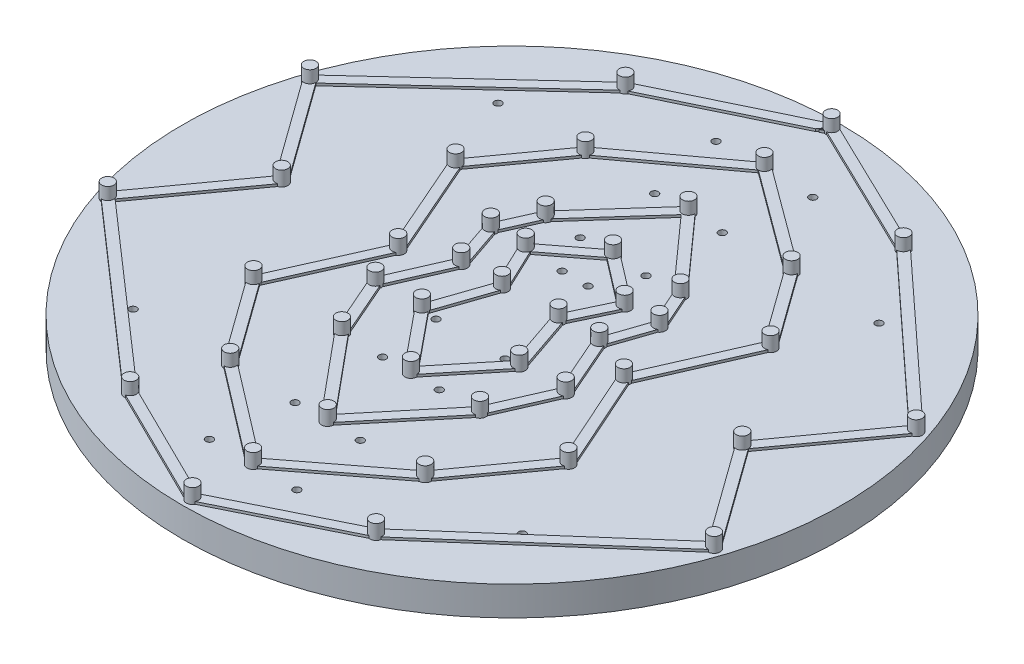
from build123d import *

# Parameters (mm, degrees)
SKETCH1_R           = 135
SKETCH1_R_2         = 7.082134324
BOSS_EXTRUDE3_DEPTH = 9
SKETCH4_R           = 135
BOSS_EXTRUDE4_DEPTH = 8
SKETCH5_R           = 2.5
SKETCH5_R_2         = 0.5
BOSS_EXTRUDE5_DEPTH = 10
BOSS_EXTRUDE7_DEPTH = 5
CUT_EXTRUDE2_START  = -9
SKETCH12_R          = 7.082134324
CUT_EXTRUDE2_DEPTH  = 9
SKETCH8_R           = 135
BOSS_EXTRUDE8_DEPTH = 4
SKETCH9_R           = 1.5
CUT_EXTRUDE1_DEPTH  = 18
CUT_EXTRUDE5_DEPTH  = 5


with BuildPart() as part:
    # Sketch1 → Boss-Extrude3 (new body)
    # profile 1 of 84: a face of its own
    with BuildSketch(Plane(origin=(0, 0, 0), x_dir=(1, 0, 0), z_dir=(0, 1, 0))):
        with Locations(Location((0, 0, 0), (0, 0, 270))):
            Circle(SKETCH1_R)
        with BuildLine():
            Line((-124.38352904, -41.253827153), (-124.277916907, -41.10729095))
            ThreePointArc((-124.277916907, -41.10729095), (-130.9, 0), (-124.277916907, 41.10729095))
            Line((-124.277916907, 41.10729095), (-124.38352904, 41.253827153))
            ThreePointArc((-124.38352904, 41.253827153), (-124.403249594, 41.513922755), (-124.180715089, 41.65))
            Line((-124.180715089, 41.65), (-124.097089007, 41.65))
            ThreePointArc((-124.097089007, 41.65), (-76.554277846, 106.180283214), (-0.308426084, 130.899636643))
            Line((-0.308426084, 130.899636643), (-0.202813951, 131.046172847))
            ThreePointArc((-0.202813951, 131.046172847), (0, 131.15), (0.202813951, 131.046172847))
            Line((0.202813951, 131.046172847), (0.308426084, 130.899636643))
            ThreePointArc((0.308426084, 130.899636643), (76.554277846, 106.180283214), (124.097089007, 41.65))
            Line((124.097089007, 41.65), (124.180715089, 41.65))
            ThreePointArc((124.180715089, 41.65), (124.403249594, 41.513922755), (124.38352904, 41.253827153))
            Line((124.38352904, 41.253827153), (124.277916907, 41.10729095))
            ThreePointArc((124.277916907, 41.10729095), (129.233875828, 20.8186296), (130.9, 0))
            ThreePointArc((130.9, 0), (129.233875828, -20.8186296), (124.277916907, -41.10729095))
            Line((124.277916907, -41.10729095), (124.38352904, -41.253827153))
            ThreePointArc((124.38352904, -41.253827153), (124.403249594, -41.513922755), (124.180715089, -41.65))
            Line((124.180715089, -41.65), (124.097089007, -41.65))
            ThreePointArc((124.097089007, -41.65), (76.554277846, -106.180283214), (0.308426084, -130.899636643))
            Line((0.308426084, -130.899636643), (0.202813951, -131.046172847))
            ThreePointArc((0.202813951, -131.046172847), (0, -131.15), (-0.202813951, -131.046172847))
            Line((-0.202813951, -131.046172847), (-0.308426084, -130.899636643))
            ThreePointArc((-0.308426084, -130.899636643), (-76.554277846, -106.180283214), (-124.097089007, -41.65))
            Line((-124.097089007, -41.65), (-124.180715089, -41.65))
            ThreePointArc((-124.180715089, -41.65), (-124.403249594, -41.513922755), (-124.38352904, -41.253827153))
        make_face(mode=Mode.SUBTRACT)
    # profile 2 of 84: a face of its own
    with BuildSketch(Plane(origin=(0, 0, 0), x_dir=(1, 0, 0), z_dir=(0, 1, 0))):
        with BuildLine():
            Line((94.650912929, 0), (124.277916907, -41.10729095))
            ThreePointArc((124.277916907, -41.10729095), (129.233875828, -20.8186296), (130.9, 0))
            ThreePointArc((130.9, 0), (129.233875828, 20.8186296), (124.277916907, 41.10729095))
            Line((124.277916907, 41.10729095), (94.650912929, 0))
        make_face()
    # profile 3 of 84: a face of its own
    with BuildSketch(Plane(origin=(0, 0, 0), x_dir=(1, 0, 0), z_dir=(0, 1, 0))):
        with BuildLine():
            Line((18.039369117, -106.298059158), (0.308426084, -130.899636643))
            ThreePointArc((0.308426084, -130.899636643), (76.554277846, -106.180283214), (124.097089007, -41.65))
            Line((124.097089007, -41.65), (64.889843958, -41.65))
            Line((64.889843958, -41.65), (79.924154275, -75.397063248))
            ThreePointArc((79.924154275, -75.397063248), (79.905473966, -75.634935118), (79.695790923, -75.748799079))
            Line((79.695790923, -75.748799079), (40.278539032, -75.748799079))
            Line((40.278539032, -75.748799079), (50.600214945, -105.967250897))
            ThreePointArc((50.600214945, -105.967250897), (50.566984629, -106.193486003), (50.363635096, -106.298059158))
            Line((50.363635096, -106.298059158), (18.039369117, -106.298059158))
        make_face()
    # profile 4 of 84: a face of its own
    with BuildSketch(Plane(origin=(0, 0, 0), x_dir=(1, 0, 0), z_dir=(0, 1, 0))):
        Polygon((39.848815576, -76.037582544), (18.399731029, -105.798059158), (50.014061514, -105.798059158), align=None)
    # profile 5 of 84: a face of its own
    with BuildSketch(Plane(origin=(0, 0, 0), x_dir=(1, 0, 0), z_dir=(0, 1, 0))):
        Polygon((0.382245002, -105.798059158), (17.78340262, -105.798059158), (39.44062029, -75.748799079), (13.528033374, -75.748799079), align=None)
    # profile 6 of 84: a face of its own
    with BuildSketch(Plane(origin=(0, 0, 0), x_dir=(1, 0, 0), z_dir=(0, 1, 0))):
        Polygon((-4e-09, -75.748799079), (-12.982280674, -75.748799079), (0, -105.42430559), (12.982280674, -75.748799079), align=None)
    # profile 7 of 84: a face of its own
    with BuildSketch(Plane(origin=(0, 0, 0), x_dir=(1, 0, 0), z_dir=(0, 1, 0))):
        Polygon((-2e-09, -106.298059158), (-17.423040707, -106.298059158), (0, -130.472424008), (17.423040707, -106.298059158), align=None)
    # profile 8 of 84: a face of its own
    with BuildSketch(Plane(origin=(0, 0, 0), x_dir=(1, 0, 0), z_dir=(0, 1, 0))):
        Polygon((-39.44062029, -75.748799079), (-17.78340262, -105.798059158), (-0.382245002, -105.798059158), (-13.528033374, -75.748799079), align=None)
    # profile 9 of 84: a face of its own
    with BuildSketch(Plane(origin=(0, 0, 0), x_dir=(1, 0, 0), z_dir=(0, 1, 0))):
        Polygon((-50.014061514, -105.798059158), (-18.399731029, -105.798059158), (-39.848815576, -76.037582544), align=None)
    # profile 10 of 84: a face of its own
    with BuildSketch(Plane(origin=(0, 0, 0), x_dir=(1, 0, 0), z_dir=(0, 1, 0))):
        with BuildLine():
            Line((-64.889843958, -41.65), (-124.097089007, -41.65))
            ThreePointArc((-124.097089007, -41.65), (-76.554277846, -106.180283214), (-0.308426084, -130.899636643))
            Line((-0.308426084, -130.899636643), (-18.039369117, -106.298059158))
            Line((-18.039369117, -106.298059158), (-50.363635096, -106.298059158))
            ThreePointArc((-50.363635096, -106.298059158), (-50.566984629, -106.193486003), (-50.600214945, -105.967250897))
            Line((-50.600214945, -105.967250897), (-40.278539032, -75.748799079))
            Line((-40.278539032, -75.748799079), (-79.695790923, -75.748799079))
            ThreePointArc((-79.695790923, -75.748799079), (-79.905473966, -75.634935118), (-79.924154275, -75.397063248))
            Line((-79.924154275, -75.397063248), (-64.889843958, -41.65))
        make_face()
    # profile 11 of 84: a face of its own
    with BuildSketch(Plane(origin=(0, 0, 0), x_dir=(1, 0, 0), z_dir=(0, 1, 0))):
        with BuildLine():
            ThreePointArc((-124.277916907, 41.10729095), (-130.9, 0), (-124.277916907, -41.10729095))
            Line((-124.277916907, -41.10729095), (-94.650912929, 0))
            Line((-94.650912929, 0), (-124.277916907, 41.10729095))
        make_face()
    # profile 12 of 84: a face of its own
    with BuildSketch(Plane(origin=(0, 0, 0), x_dir=(1, 0, 0), z_dir=(0, 1, 0))):
        with BuildLine():
            ThreePointArc((-0.308426084, 130.899636643), (-76.554277846, 106.180283214), (-124.097089007, 41.65))
            Line((-124.097089007, 41.65), (-64.887027362, 41.65))
            Line((-64.887027362, 41.65), (-78.251547748, 72.199247985))
            ThreePointArc((-78.251547748, 72.199247985), (-78.231730987, 72.436287213), (-78.022506278, 72.549447812))
            Line((-78.022506278, 72.549447812), (-42.629642686, 72.549447812))
            Line((-42.629642686, 72.549447812), (-57.169541703, 103.285033746))
            ThreePointArc((-57.169541703, 103.285033746), (-57.154771859, 103.525681685), (-56.943553046, 103.641940842))
            Line((-56.943553046, 103.641940842), (-19.953696869, 103.641940842))
            Line((-19.953696869, 103.641940842), (-0.308426084, 130.899636643))
        make_face()
    # profile 13 of 84: a face of its own
    with BuildSketch(Plane(origin=(0, 0, 0), x_dir=(1, 0, 0), z_dir=(0, 1, 0))):
        Polygon((-42.189962082, 72.789255758), (-20.314058782, 103.141940842), (-56.548724494, 103.141940842), align=None)
    # profile 14 of 84: a face of its own
    with BuildSketch(Plane(origin=(0, 0, 0), x_dir=(1, 0, 0), z_dir=(0, 1, 0))):
        Polygon((-0.385061599, 103.141940842), (-19.697730373, 103.141940842), (-41.746468973, 72.549447812), (-14.014011478, 72.549447812), align=None)
    # profile 15 of 84: a face of its own
    with BuildSketch(Plane(origin=(0, 0, 0), x_dir=(1, 0, 0), z_dir=(0, 1, 0))):
        Polygon((0, 102.777604677), (-13.466638187, 72.549447812), (0, 72.549447812), (13.466638187, 72.549447812), align=None)
    # profile 16 of 84: a face of its own
    with BuildSketch(Plane(origin=(0, 0, 0), x_dir=(1, 0, 0), z_dir=(0, 1, 0))):
        Polygon((0, 130.472424008), (-19.33736846, 103.641940842), (-4e-09, 103.641940842), (19.33736846, 103.641940842), align=None)
    # profile 17 of 84: a face of its own
    with BuildSketch(Plane(origin=(0, 0, 0), x_dir=(1, 0, 0), z_dir=(0, 1, 0))):
        Polygon((41.746468973, 72.549447812), (19.697730373, 103.141940842), (0.385061599, 103.141940842), (14.014011478, 72.549447812), align=None)
    # profile 18 of 84: a face of its own
    with BuildSketch(Plane(origin=(0, 0, 0), x_dir=(1, 0, 0), z_dir=(0, 1, 0))):
        Polygon((56.548724494, 103.141940842), (20.314058782, 103.141940842), (42.189962082, 72.789255758), align=None)
    # profile 19 of 84: a face of its own
    with BuildSketch(Plane(origin=(0, 0, 0), x_dir=(1, 0, 0), z_dir=(0, 1, 0))):
        Polygon((42.723159295, 72.049447812), (64.451376596, 41.901676169), (77.640261276, 72.049447812), align=None)
    # profile 20 of 84: a face of its own
    with BuildSketch(Plane(origin=(0, 0, 0), x_dir=(1, 0, 0), z_dir=(0, 1, 0))):
        Polygon((64.99312752, 41.15), (94.342748724, 0.427575992), (123.692369928, 41.15), align=None)
    # profile 21 of 84: a face of its own
    with BuildSketch(Plane(origin=(0, 0, 0), x_dir=(1, 0, 0), z_dir=(0, 1, 0))):
        Polygon((94.342748724, -0.427575992), (64.99312752, -41.15), (123.692369928, -41.15), align=None)
    # profile 22 of 84: a face of its own
    with BuildSketch(Plane(origin=(0, 0, 0), x_dir=(1, 0, 0), z_dir=(0, 1, 0))):
        Polygon((46.501999473, -0.37535968), (64.556200791, -40.90108124), (94.034584519, 0), (64.558188122, 40.898323831), align=None)
    # profile 23 of 84: a face of its own
    with BuildSketch(Plane(origin=(0, 0, 0), x_dir=(1, 0, 0), z_dir=(0, 1, 0))):
        Polygon((34.76781542, 25.964009606), (46.226642998, 0.242724701), (64.122537357, 41.15), (28.002459562, 41.15), align=None)
    # profile 24 of 84: a face of its own
    with BuildSketch(Plane(origin=(0, 0, 0), x_dir=(1, 0, 0), z_dir=(0, 1, 0))):
        Polygon((20.661887706, 26.112273784), (34.154390465, 26.112273784), (27.610580002, 40.800967905), align=None)
    # profile 25 of 84: a face of its own
    with BuildSketch(Plane(origin=(0, 0, 0), x_dir=(1, 0, 0), z_dir=(0, 1, 0))):
        Polygon((28.012226515, 41.65), (64.016437198, 41.65), (42.279666185, 71.809639867), align=None)
    # profile 26 of 84: a face of its own
    with BuildSketch(Plane(origin=(0, 0, 0), x_dir=(1, 0, 0), z_dir=(0, 1, 0))):
        Polygon((41.839985581, 72.049447812), (14.236761384, 72.049447812), (27.624215923, 41.999032095), align=None)
    # profile 27 of 84: a face of its own
    with BuildSketch(Plane(origin=(0, 0, 0), x_dir=(1, 0, 0), z_dir=(0, 1, 0))):
        Polygon((20.276224505, 26.46626798), (27.22256941, 41.15), (13.86765052, 41.15), align=None)
    # profile 28 of 84: a face of its own
    with BuildSketch(Plane(origin=(0, 0, 0), x_dir=(1, 0, 0), z_dir=(0, 1, 0))):
        Polygon((27.232336364, 41.65), (13.689388092, 72.049447812), (0.381882927, 72.049447812), (13.649430316, 41.65), align=None)
    # profile 29 of 84: a face of its own
    with BuildSketch(Plane(origin=(0, 0, 0), x_dir=(1, 0, 0), z_dir=(0, 1, 0))):
        Polygon((0, 71.674453378), (-13.103884665, 41.65), (0, 41.65), (13.103884665, 41.65), align=None)
    # profile 30 of 84: a face of its own
    with BuildSketch(Plane(origin=(0, 0, 0), x_dir=(1, 0, 0), z_dir=(0, 1, 0))):
        Polygon((-0.349573581, 41.15), (-13.322104869, 41.15), (-19.885176226, 26.112273784), (-5.485989484, 26.112273784), align=None)
    # profile 31 of 84: a face of its own
    with BuildSketch(Plane(origin=(0, 0, 0), x_dir=(1, 0, 0), z_dir=(0, 1, 0))):
        Polygon((-27.610580002, 40.800967905), (-34.154390465, 26.112273784), (-20.661887706, 26.112273784), align=None)
    # profile 32 of 84: a face of its own
    with BuildSketch(Plane(origin=(0, 0, 0), x_dir=(1, 0, 0), z_dir=(0, 1, 0))):
        Polygon((-13.86765052, 41.15), (-27.22256941, 41.15), (-20.276224505, 26.46626798), align=None)
    # profile 33 of 84: a face of its own
    with BuildSketch(Plane(origin=(0, 0, 0), x_dir=(1, 0, 0), z_dir=(0, 1, 0))):
        Polygon((-13.689388092, 72.049447812), (-27.232336364, 41.65), (-13.649430316, 41.65), (-0.381882927, 72.049447812), align=None)
    # profile 34 of 84: a face of its own
    with BuildSketch(Plane(origin=(0, 0, 0), x_dir=(1, 0, 0), z_dir=(0, 1, 0))):
        Polygon((-14.236761384, 72.049447812), (-41.839985581, 72.049447812), (-27.624215923, 41.999032095), align=None)
    # profile 35 of 84: a face of its own
    with BuildSketch(Plane(origin=(0, 0, 0), x_dir=(1, 0, 0), z_dir=(0, 1, 0))):
        Polygon((-77.640261276, 72.049447812), (-64.451376596, 41.901676169), (-42.723159295, 72.049447812), align=None)
    # profile 36 of 84: a face of its own
    with BuildSketch(Plane(origin=(0, 0, 0), x_dir=(1, 0, 0), z_dir=(0, 1, 0))):
        Polygon((-42.279666185, 71.809639867), (-64.016437198, 41.65), (-28.012226515, 41.65), align=None)
    # profile 37 of 84: a face of its own
    with BuildSketch(Plane(origin=(0, 0, 0), x_dir=(1, 0, 0), z_dir=(0, 1, 0))):
        Polygon((-64.122537357, 41.15), (-46.226642998, 0.242724701), (-34.767815423, 25.9640096), (-28.002459562, 41.15), align=None)
    # profile 38 of 84: a face of its own
    with BuildSketch(Plane(origin=(0, 0, 0), x_dir=(1, 0, 0), z_dir=(0, 1, 0))):
        Polygon((-123.692369928, 41.15), (-94.342748724, 0.427575992), (-64.99312752, 41.15), align=None)
    # profile 39 of 84: a face of its own
    with BuildSketch(Plane(origin=(0, 0, 0), x_dir=(1, 0, 0), z_dir=(0, 1, 0))):
        Polygon((-94.342748724, -0.427575992), (-123.692369928, -41.15), (-64.99312752, -41.15), align=None)
    # profile 40 of 84: a face of its own
    with BuildSketch(Plane(origin=(0, 0, 0), x_dir=(1, 0, 0), z_dir=(0, 1, 0))):
        Polygon((-64.558188122, 40.898323831), (-94.034584519, 0), (-64.556200791, -40.90108124), (-46.501999473, -0.37535968), align=None)
    # profile 41 of 84: a face of its own
    with BuildSketch(Plane(origin=(0, 0, 0), x_dir=(1, 0, 0), z_dir=(0, 1, 0))):
        Polygon((-46.230800318, -0.995279439), (-64.11972076, -41.15), (-28.66412955, -41.15), (-39.194128118, -17.080035031), align=None)
    # profile 42 of 84: a face of its own
    with BuildSketch(Plane(origin=(0, 0, 0), x_dir=(1, 0, 0), z_dir=(0, 1, 0))):
        Polygon((79.310729324, -75.248799079), (64.453363927, -41.89891876), (40.417310612, -75.248799079), align=None)
    # profile 43 of 84: a face of its own
    with BuildSketch(Plane(origin=(0, 0, 0), x_dir=(1, 0, 0), z_dir=(0, 1, 0))):
        Polygon((-40.417310612, -75.248799079), (-64.453363927, -41.89891876), (-79.310729324, -75.248799079), align=None)
    # profile 44 of 84: a face of its own
    with BuildSketch(Plane(origin=(0, 0, 0), x_dir=(1, 0, 0), z_dir=(0, 1, 0))):
        Polygon((-28.631458129, -41.65), (-64.016437198, -41.65), (-40.009115326, -74.960015614), align=None)
    # profile 45 of 84: a face of its own
    with BuildSketch(Plane(origin=(0, 0, 0), x_dir=(1, 0, 0), z_dir=(0, 1, 0))):
        Polygon((-13.746770679, -75.248799079), (-28.253174133, -42.089381183), (-39.579391869, -75.248799079), align=None)
    # profile 46 of 84: a face of its own
    with BuildSketch(Plane(origin=(0, 0, 0), x_dir=(1, 0, 0), z_dir=(0, 1, 0))):
        Polygon((-11.798316719, -41.65), (-27.899639545, -41.65), (-13.20101798, -75.248799079), (-0.349305009, -75.248799079), align=None)
    # profile 47 of 84: a face of its own
    with BuildSketch(Plane(origin=(0, 0, 0), x_dir=(1, 0, 0), z_dir=(0, 1, 0))):
        Polygon((1e-09, -41.65), (-11.270084989, -41.65), (0, -74.72371245), (11.270084989, -41.65), align=None)
    # profile 48 of 84: a face of its own
    with BuildSketch(Plane(origin=(0, 0, 0), x_dir=(1, 0, 0), z_dir=(0, 1, 0))):
        Polygon((28.253174133, -42.089381183), (13.746770679, -75.248799079), (39.579391869, -75.248799079), align=None)
    # profile 49 of 84: a face of its own
    with BuildSketch(Plane(origin=(0, 0, 0), x_dir=(1, 0, 0), z_dir=(0, 1, 0))):
        Polygon((28.66412955, -41.15), (64.11972076, -41.15), (46.230800318, -0.995279439), (39.194128143, -17.080034973), align=None)
    # profile 50 of 84: a face of its own
    with BuildSketch(Plane(origin=(0, 0, 0), x_dir=(1, 0, 0), z_dir=(0, 1, 0))):
        Polygon((40.009115326, -74.960015614), (64.016437198, -41.65), (28.631458129, -41.65), align=None)
    # profile 51 of 84: a face of its own
    with BuildSketch(Plane(origin=(0, 0, 0), x_dir=(1, 0, 0), z_dir=(0, 1, 0))):
        Polygon((0.349305009, -75.248799079), (13.20101798, -75.248799079), (27.899639545, -41.65), (11.798316719, -41.65), align=None)
    # profile 52 of 84: a face of its own
    with BuildSketch(Plane(origin=(0, 0, 0), x_dir=(1, 0, 0), z_dir=(0, 1, 0))):
        Polygon((19.94100333, -17.754095418), (11.968695007, -41.15), (27.932310966, -41.15), align=None)
    # profile 53 of 84: a face of its own
    with BuildSketch(Plane(origin=(0, 0, 0), x_dir=(1, 0, 0), z_dir=(0, 1, 0))):
        Polygon((20.290295308, -17.229835196), (28.310594963, -40.710618817), (38.582841649, -17.229835196), align=None)
    # profile 54 of 84: a face of its own
    with BuildSketch(Plane(origin=(0, 0, 0), x_dir=(1, 0, 0), z_dir=(0, 1, 0))):
        Polygon((38.965357754, -16.355461929), (45.955443842, -0.377195058), (34.57048907, 25.178269787), (28.549732773, 7.509480006), align=None)
    # profile 55 of 84: a face of its own
    with BuildSketch(Plane(origin=(0, 0, 0), x_dir=(1, 0, 0), z_dir=(0, 1, 0))):
        Polygon((20.64894208, 25.612273784), (28.253100546, 8.189142616), (34.190147055, 25.612273784), align=None)
    # profile 56 of 84: a face of its own
    with BuildSketch(Plane(origin=(0, 0, 0), x_dir=(1, 0, 0), z_dir=(0, 1, 0))):
        Polygon((19.885176226, 26.112273784), (13.322104869, 41.15), (0.349573581, 41.15), (5.485989484, 26.112273784), align=None)
    # profile 57 of 84: a face of its own
    with BuildSketch(Plane(origin=(0, 0, 0), x_dir=(1, 0, 0), z_dir=(0, 1, 0))):
        Polygon((0, 40.626564221), (-4.957626648, 26.112273784), (4.957626648, 26.112273784), align=None)
    # profile 58 of 84: a face of its own
    with BuildSketch(Plane(origin=(0, 0, 0), x_dir=(1, 0, 0), z_dir=(0, 1, 0))):
        Polygon((-34.190147055, 25.612273784), (-28.253100546, 8.189142616), (-20.64894208, 25.612273784), align=None)
    # profile 59 of 84: a face of its own
    with BuildSketch(Plane(origin=(0, 0, 0), x_dir=(1, 0, 0), z_dir=(0, 1, 0))):
        Polygon((-34.57048907, 25.178269787), (-45.955443842, -0.377195058), (-38.965357754, -16.355461929), (-28.549732773, 7.509480006), align=None)
    # profile 60 of 84: a face of its own
    with BuildSketch(Plane(origin=(0, 0, 0), x_dir=(1, 0, 0), z_dir=(0, 1, 0))):
        Polygon((-38.582841649, -17.229835196), (-28.310594963, -40.710618817), (-20.290295308, -17.229835196), align=None)
    # profile 61 of 84: a face of its own
    with BuildSketch(Plane(origin=(0, 0, 0), x_dir=(1, 0, 0), z_dir=(0, 1, 0))):
        Polygon((-19.94100333, -17.754095418), (-27.932310966, -41.15), (-11.968695007, -41.15), align=None)
    # profile 62 of 84: a face of its own
    with BuildSketch(Plane(origin=(0, 0, 0), x_dir=(1, 0, 0), z_dir=(0, 1, 0))):
        Polygon((-19.591416717, -17.229835196), (-11.440463277, -41.15), (-0.433398927, -41.15), (-14.268343199, -17.229835196), align=None)
    # profile 63 of 84: a face of its own
    with BuildSketch(Plane(origin=(0, 0, 0), x_dir=(1, 0, 0), z_dir=(0, 1, 0))):
        Polygon((3e-09, -17.229835196), (-13.690735332, -17.229835196), (0, -40.900667473), (13.690735332, -17.229835196), align=None)
    # profile 64 of 84: a face of its own
    with BuildSketch(Plane(origin=(0, 0, 0), x_dir=(1, 0, 0), z_dir=(0, 1, 0))):
        Polygon((0.433398927, -41.15), (11.440463277, -41.15), (19.591416717, -17.229835196), (14.268343199, -17.229835196), align=None)
    # profile 65 of 84: a face of its own
    with BuildSketch(Plane(origin=(0, 0, 0), x_dir=(1, 0, 0), z_dir=(0, 1, 0))):
        Polygon((38.583203725, -16.729835196), (28.310542102, 6.807540005), (20.290026735, -16.729835196), align=None)
    # profile 66 of 84: a face of its own
    with BuildSketch(Plane(origin=(0, 0, 0), x_dir=(1, 0, 0), z_dir=(0, 1, 0))):
        Polygon((27.899938397, 7.74834131), (20.257893801, 25.258279588), (11.974572478, 7.74834131), align=None)
    # profile 67 of 84: a face of its own
    with BuildSketch(Plane(origin=(0, 0, 0), x_dir=(1, 0, 0), z_dir=(0, 1, 0))):
        Polygon((19.872230601, 25.612273784), (5.656773811, 25.612273784), (11.61719592, 8.162130043), align=None)
    # profile 68 of 84: a face of its own
    with BuildSketch(Plane(origin=(0, 0, 0), x_dir=(1, 0, 0), z_dir=(0, 1, 0))):
        Polygon((-5.656773811, 25.612273784), (-19.872230601, 25.612273784), (-11.61719592, 8.162130043), align=None)
    # profile 69 of 84: a face of its own
    with BuildSketch(Plane(origin=(0, 0, 0), x_dir=(1, 0, 0), z_dir=(0, 1, 0))):
        Polygon((5.128410975, 25.612273784), (-5.128410975, 25.612273784), (-11.230170344, 7.74834131), (2.5e-08, 7.74834131), (11.230170344, 7.74834131), align=None)
    # profile 70 of 84: a face of its own
    with BuildSketch(Plane(origin=(0, 0, 0), x_dir=(1, 0, 0), z_dir=(0, 1, 0))):
        Polygon((-20.290026735, -16.729835196), (-28.310542102, 6.807540005), (-38.583203725, -16.729835196), align=None)
    # profile 71 of 84: a face of its own
    with BuildSketch(Plane(origin=(0, 0, 0), x_dir=(1, 0, 0), z_dir=(0, 1, 0))):
        Polygon((-11.974572478, 7.74834131), (-20.257893801, 25.258279588), (-27.899938397, 7.74834131), align=None)
    # profile 72 of 84: a face of its own
    with BuildSketch(Plane(origin=(0, 0, 0), x_dir=(1, 0, 0), z_dir=(0, 1, 0))):
        Polygon((-27.22480771, 5.171466918), (-19.940440123, -16.205574975), (-18.054398633, -10.683869549), align=None)
    # profile 73 of 84: a face of its own
    with BuildSketch(Plane(origin=(0, 0, 0), x_dir=(1, 0, 0), z_dir=(0, 1, 0))):
        Polygon((-11.929317507, 7.24834131), (-27.848422397, 7.24834131), (-17.839938025, -10.05599985), align=None)
    # profile 74 of 84: a face of its own
    with BuildSketch(Plane(origin=(0, 0, 0), x_dir=(1, 0, 0), z_dir=(0, 1, 0))):
        Polygon((11.929317507, 7.24834131), (17.839938025, -10.05599985), (27.848422397, 7.24834131), align=None)
    # profile 75 of 84: a face of its own
    with BuildSketch(Plane(origin=(0, 0, 0), x_dir=(1, 0, 0), z_dir=(0, 1, 0))):
        Polygon((18.054398633, -10.683869549), (19.940440123, -16.205574975), (27.22480771, 5.171466918), align=None)
    # profile 76 of 84: a face of its own
    with BuildSketch(Plane(origin=(0, 0, 0), x_dir=(1, 0, 0), z_dir=(0, 1, 0))):
        Polygon((17.722212167, -11.25820905), (14.557533185, -16.729835196), (19.591148145, -16.729835196), align=None)
    # profile 77 of 84: a face of its own
    with BuildSketch(Plane(origin=(0, 0, 0), x_dir=(1, 0, 0), z_dir=(0, 1, 0))):
        Polygon((-17.722212167, -11.25820905), (-19.591148145, -16.729835196), (-14.557533185, -16.729835196), align=None)
    # profile 78 of 84: a face of its own
    with BuildSketch(Plane(origin=(0, 0, 0), x_dir=(1, 0, 0), z_dir=(0, 1, 0))):
        Polygon((-17.50775156, -10.630339352), (-13.979925318, -16.729835196), (-0.394828552, -16.729835196), (-6.853905402, -3.076128844), (-11.542291931, 6.834552578), align=None)
    # profile 79 of 84: a face of its own
    with BuildSketch(Plane(origin=(0, 0, 0), x_dir=(1, 0, 0), z_dir=(0, 1, 0))):
        Polygon((0.394828552, -16.729835196), (13.979925318, -16.729835196), (17.50775156, -10.630339352), (11.542291931, 6.834552578), (6.853905369, -3.076128913), align=None)
    # profile 80 of 84: a face of its own
    with BuildSketch(Plane(origin=(0, 0, 0), x_dir=(1, 0, 0), z_dir=(0, 1, 0))):
        with BuildLine():
            Line((-5.243999611, -5.310035244), (0, -16.395215445))
            Line((0, -16.395215445), (5.243999611, -5.310035244))
            ThreePointArc((5.243999611, -5.310035244), (0, -7.415927337), (-5.243999611, -5.310035244))
        make_face()
    # profile 81 of 84: a face of its own
    with BuildSketch(Plane(origin=(0, 0, 0), x_dir=(1, 0, 0), z_dir=(0, 1, 0))):
        with BuildLine():
            Line((-11.184915373, 7.24834131), (-7.559856546, -0.414594104))
            ThreePointArc((-7.559856546, -0.414594104), (-6.405957651, 4.222371119), (-2.707791411, 7.24834131))
            Line((-2.707791411, 7.24834131), (-11.184915373, 7.24834131))
        make_face()
    # profile 82 of 84: a face of its own
    with BuildSketch(Plane(origin=(0, 0, 0), x_dir=(1, 0, 0), z_dir=(0, 1, 0))):
        with BuildLine():
            ThreePointArc((7.582134324, 0.166206987), (7.576562832, -0.124407107), (7.559856546, -0.414594104))
            Line((7.559856546, -0.414594104), (11.184915373, 7.24834131))
            Line((11.184915373, 7.24834131), (2.707791411, 7.24834131))
            ThreePointArc((2.707791411, 7.24834131), (6.245782541, 4.464923232), (7.582134324, 0.166206987))
        make_face()
    # profile 83 of 84: a face of its own
    with BuildSketch(Plane(origin=(0, 0, 0), x_dir=(1, 0, 0), z_dir=(0, 1, 0))):
        with Locations(Location((0, 0.166206987, 0), (0, 0, 270))):
            Circle(SKETCH1_R_2)
    # profile 84 of 84: a face of its own
    with BuildSketch(Plane(origin=(0, 0, 0), x_dir=(1, 0, 0), z_dir=(0, 1, 0))):
        with BuildLine():
            ThreePointArc((124.097089007, 41.65), (76.554277846, 106.180283214), (0.308426084, 130.899636643))
            Line((0.308426084, 130.899636643), (19.953696869, 103.641940842))
            Line((19.953696869, 103.641940842), (56.943553046, 103.641940842))
            ThreePointArc((56.943553046, 103.641940842), (57.154771859, 103.525681685), (57.169541703, 103.285033746))
            Line((57.169541703, 103.285033746), (42.629642686, 72.549447812))
            Line((42.629642686, 72.549447812), (78.022506278, 72.549447812))
            ThreePointArc((78.022506278, 72.549447812), (78.231730987, 72.436287213), (78.251547748, 72.199247985))
            Line((78.251547748, 72.199247985), (64.887027362, 41.65))
            Line((64.887027362, 41.65), (124.097089007, 41.65))
        make_face()
    extrude(amount=BOSS_EXTRUDE3_DEPTH)

    # Sketch4 → Boss-Extrude4 (add)
    with BuildSketch(Plane.XZ):
        with Locations(Location((0, 0, 0), (0, 0, 270))):
            Circle(SKETCH4_R)
    extrude(amount=-BOSS_EXTRUDE4_DEPTH)

    # Sketch5 → Boss-Extrude5 (add)
    with BuildSketch(Plane(origin=(0, 8, 0), x_dir=(1, 0, 0), z_dir=(0, 1, 0))):
        with Locations(Location((-64.504782359, 41.4, 0), (0, 0, 107.888986274))):
            Circle(SKETCH5_R)
        with Locations(Location((-64.504782359, -41.4, 0), (0, 0, 71.726207321))):
            Circle(SKETCH5_R)
        with Locations(Location((64.504782359, -41.4, 0), (0, 0, 108.273792679))):
            Circle(SKETCH5_R)
        with Locations(Location((64.504782359, 41.4, 0), (0, 0, 72.111013726))):
            Circle(SKETCH5_R)
        with Locations(Location((-124.180715089, 41.4, 0), (0, 0, 5.739170477))):
            Circle(SKETCH5_R)
        with Locations(Location((-124.180715089, -41.4, 0), (0, 0, 59.957979549))):
            Circle(SKETCH5_R)
        with Locations(Location((124.180715089, -41.4, 0), (0, 0, 120.042020451))):
            Circle(SKETCH5_R)
        with Locations(Location((124.180715089, 41.4, 0), (0, 0, 174.260829523))):
            Circle(SKETCH5_R)
        with Locations(Location((0, -130.9, 0), (0, 0, 59.957979549))):
            Circle(SKETCH5_R)
        with Locations(Location((0, 130.9, 0), (0, 0, 228.479638594))):
            Circle(SKETCH5_R)
        with Locations(Location((-50.363635096, -106.048059158, 0), (0, 0, 76.880611758))):
            Circle(SKETCH5_R)
        with Locations(Location((50.363635096, -106.048059158, 0), (0, 0, 103.119388242))):
            Circle(SKETCH5_R)
        with Locations(Location((0, -106.048059158, 0), (0, 0, 107.888986274))):
            Circle(SKETCH5_R)
        with Locations(Location((0, 103.391940842, 0), (0, 0, 5.739170477))):
            Circle(SKETCH5_R)
        with Locations(Location((94.342748724, 0, 0), (0, 0, 59.957979549))):
            Circle(SKETCH5_R)
        with Locations(Location((56.943553046, 103.391940842, 0), (0, 0, 174.260829523))):
            Circle(SKETCH5_R)
        with Locations(Location((-56.943553046, 103.391940842, 0), (0, 0, 5.739170477))):
            Circle(SKETCH5_R)
        with Locations(Location((-42.234814134, 72.299447812, 0), (0, 0, 109.577974891))):
            Circle(SKETCH5_R)
        with Locations(Location((-39.928965451, -75.498799079, 0), (0, 0, 76.880611758))):
            Circle(SKETCH5_R)
        with Locations(Location((39.928965451, -75.498799079, 0), (0, 0, 103.119388242))):
            Circle(SKETCH5_R)
        with Locations(Location((46.228721658, -0.376277369, 0), (0, 0, 72.111013726))):
            Circle(SKETCH5_R)
        with Locations(Location((42.234814134, 72.299447812, 0), (0, 0, 70.422025109))):
            Circle(SKETCH5_R)
        with Locations(Location((0, 72.299447812, 0), (0, 0, 5.739170477))):
            Circle(SKETCH5_R)
        with Locations(Location((-27.617397963, 41.4, 0), (0, 0, 71.726207321))):
            Circle(SKETCH5_R)
        with Locations(Location((-34.539452064, 25.862273784, 0), (0, 0, 71.726207321))):
            Circle(SKETCH5_R)
        with Locations(Location((-28.281821324, 7.49834131, 0), (0, 0, 103.077710518))):
            Circle(SKETCH5_R)
        with Locations(Location((-38.965086652, -16.979835196, 0), (0, 0, 72.160769311))):
            Circle(SKETCH5_R)
        with Locations(Location((-28.281884548, -41.4, 0), (0, 0, 76.880611758))):
            Circle(SKETCH5_R)
        with Locations(Location((0, -75.498799079, 0), (0, 0, 76.922289482))):
            Circle(SKETCH5_R)
        with Locations(Location((28.281884548, -41.4, 0), (0, 0, 103.119388242))):
            Circle(SKETCH5_R)
        with Locations(Location((38.965086652, -16.979835196, 0), (0, 0, 107.839230689))):
            Circle(SKETCH5_R)
        with Locations(Location((28.281821324, 7.49834131, 0), (0, 0, 76.922289482))):
            Circle(SKETCH5_R)
        with Locations(Location((34.539452064, 25.862273784, 0), (0, 0, 108.273792679))):
            Circle(SKETCH5_R)
        with Locations(Location((27.617397963, 41.4, 0), (0, 0, 108.273792679))):
            Circle(SKETCH5_R)
        with Locations(Location((-94.342748724, 0, 0), (0, 0, 59.957979549))):
            Circle(SKETCH5_R)
        with Locations(Location((-46.228721658, -0.376277369, 0), (0, 0, 107.888986274))):
            Circle(SKETCH5_R)
        with Locations(Location((0, -41.4, 0), (0, 0, 65.694941947))):
            Circle(SKETCH5_R)
        with Locations(Location((19.940721726, -16.979835196, 0), (0, 0, 76.922289482))):
            Circle(SKETCH5_R)
        with Locations(Location((11.579743926, 7.49834131, 0), (0, 0, 103.119388242))):
            Circle(SKETCH5_R)
        with Locations(Location((20.267059153, 25.862273784, 0), (0, 0, 107.839230689))):
            Circle(SKETCH5_R)
        with Locations(Location((0, 41.4, 0), (0, 0, 5.739170477))):
            Circle(SKETCH5_R)
        with Locations(Location((-20.267059153, 25.862273784, 0), (0, 0, 72.160769311))):
            Circle(SKETCH5_R)
        with Locations(Location((-11.579743926, 7.49834131, 0), (0, 0, 76.880611758))):
            Circle(SKETCH5_R)
        with Locations(Location((-19.940721726, -16.979835196, 0), (0, 0, 103.077710518))):
            Circle(SKETCH5_R)
        with Locations(Location((-79.695790923, -75.498799079, 0), (0, 0, 95.987036844))):
            Circle(SKETCH5_R_2)
        with Locations(Location((-78.022506278, 72.299447812, 0), (0, 0, 30))):
            Circle(SKETCH5_R_2)
        with Locations(Location((78.022506278, 72.299447812, 0), (0, 0, 150))):
            Circle(SKETCH5_R_2)
        with Locations(Location((79.695790923, -75.498799079, 0), (0, 0, 84.012963156))):
            Circle(SKETCH5_R_2)
        with Locations(Location((-17.911385868, -106.048059158, 0), (0, 0, 95.781190929))):
            Circle(SKETCH5_R_2)
        with Locations(Location((17.911385868, -106.048059158, 0), (0, 0, 84.218809071))):
            Circle(SKETCH5_R_2)
        with Locations(Location((19.825713621, 103.391940842, 0), (0, 0, 95.781190929))):
            Circle(SKETCH5_R_2)
        with Locations(Location((-19.825713621, 103.391940842, 0), (0, 0, 84.218809071))):
            Circle(SKETCH5_R_2)
        with Locations(Location((13.851699785, 72.299447812, 0), (0, 0, 84.012963156))):
            Circle(SKETCH5_R_2)
        with Locations(Location((-13.851699785, 72.299447812, 0), (0, 0, 95.987036844))):
            Circle(SKETCH5_R_2)
        with Locations(Location((13.485767593, 41.4, 0), (0, 0, 83.578401166))):
            Circle(SKETCH5_R_2)
        with Locations(Location((-13.485767593, 41.4, 0), (0, 0, 96.421598834))):
            Circle(SKETCH5_R_2)
        with Locations(Location((5.307200229, 25.862273784, 0), (0, 0, 78.85855872))):
            Circle(SKETCH5_R_2)
        with Locations(Location((-5.307200229, 25.862273784, 0), (0, 0, 101.14144128))):
            Circle(SKETCH5_R_2)
        with Locations(Location((14.124134258, -16.979835196, 0), (0, 0, 89.95577147))):
            Circle(SKETCH5_R_2)
        with Locations(Location((-14.124134258, -16.979835196, 0), (0, 0, 90.04422853))):
            Circle(SKETCH5_R_2)
        with Locations(Location((11.619389998, -41.4, 0), (0, 0, 101.183119005))):
            Circle(SKETCH5_R_2)
        with Locations(Location((-11.619389998, -41.4, 0), (0, 0, 78.816880995))):
            Circle(SKETCH5_R_2)
        with Locations(Location((-13.364525677, -75.498799079, 0), (0, 0, 83.628156752))):
            Circle(SKETCH5_R_2)
        with Locations(Location((13.364525677, -75.498799079, 0), (0, 0, 96.371843248))):
            Circle(SKETCH5_R_2)
    extrude(amount=BOSS_EXTRUDE5_DEPTH)

    # Boss-Extrude7: read off the stored shape, not the designer's step
    # Boss-Extrude7 outline → Boss-Extrude7 (add)
    with BuildSketch(Plane(origin=(0, 8, 0), x_dir=(1, 0, 0), z_dir=(0, 1, 0))):
        with BuildLine():
            Line((-1.251587511, 128.735853817), (-1.983110413, 127.720870163))
            Line((-1.983110413, 127.720870163), (-0.480698107, 128.446649367))
            ThreePointArc((-0.480698107, 128.446649367), (-0.878130497, 128.559297791), (-1.251587511, 128.735853817))
        make_face()
        with BuildLine():
            Line((-2.928637685, 127.264108708), (-1.657215414, 129.02819951))
            ThreePointArc((-1.657215414, 129.02819951), (-2.457604414, 130.441545481), (-2.220621138, 132.04840836))
            Line((-2.220621138, 132.04840836), (-56.46285494, 105.845291476))
            ThreePointArc((-56.46285494, 105.845291476), (-54.692453676, 104.479392737), (-54.722931908, 102.243532483))
            Line((-54.722931908, 102.243532483), (-2.928637685, 127.264108708))
        make_face()
        with BuildLine():
            ThreePointArc((2.220621138, 132.04840836), (2.251099371, 129.812548106), (0.480698107, 128.446649367))
            Line((0.480698107, 128.446649367), (54.722931908, 102.243532483))
            ThreePointArc((54.722931908, 102.243532483), (54.692453676, 104.479392737), (56.46285494, 105.845291476))
            Line((56.46285494, 105.845291476), (2.220621138, 132.04840836))
        make_face()
        with BuildLine():
            Line((56.690659405, 100.904764771), (121.521700716, 41.131241387))
            Line((121.521700716, 41.131241387), (93.597274194, 2.386266482))
            ThreePointArc((93.597274194, 2.386266482), (95.804477192, 2.028139513), (96.842297416, 0.047500933))
            Line((96.842297416, 0.047500933), (124.926189619, 39.013733518))
            ThreePointArc((124.926189619, 39.013733518), (121.693388144, 41.148594612), (124.43360873, 43.887176071))
            Line((124.43360873, 43.887176071), (59.402052293, 103.845572246))
            ThreePointArc((59.402052293, 103.845572246), (58.781557718, 101.697320287), (56.690659405, 100.904764771))
        make_face()
        with BuildLine():
            Line((-121.521700716, 41.131241387), (-56.690659405, 100.904764771))
            ThreePointArc((-56.690659405, 100.904764771), (-58.781557718, 101.697320287), (-59.402052293, 103.845572246))
            Line((-59.402052293, 103.845572246), (-124.43360873, 43.887176071))
            ThreePointArc((-124.43360873, 43.887176071), (-121.693388144, 41.148594612), (-124.926189619, 39.013733518))
            Line((-124.926189619, 39.013733518), (-96.842297416, 0.047500933))
            ThreePointArc((-96.842297416, 0.047500933), (-95.804477192, 2.028139513), (-93.597274194, 2.386266482))
            Line((-93.597274194, 2.386266482), (-121.521700716, 41.131241387))
        make_face()
        with BuildLine():
            Line((93.597274194, -2.386266482), (121.494711581, -41.093794124))
            Line((121.494711581, -41.093794124), (50.174379813, -103.555232963))
            ThreePointArc((50.174379813, -103.555232963), (52.244342882, -104.400959215), (52.809739722, -106.564365421))
            Line((52.809739722, -106.564365421), (124.369970371, -43.892826195))
            ThreePointArc((124.369970371, -43.892826195), (121.696803598, -41.116832724), (124.926189619, -39.013733518))
            Line((124.926189619, -39.013733518), (96.842297416, -0.047500933))
            ThreePointArc((96.842297416, -0.047500933), (95.804477192, -2.028139513), (93.597274194, -2.386266482))
        make_face()
        with BuildLine():
            Line((-121.494711581, -41.093794124), (-93.597274194, -2.386266482))
            ThreePointArc((-93.597274194, -2.386266482), (-95.804477192, -2.028139513), (-96.842297416, -0.047500933))
            Line((-96.842297416, -0.047500933), (-124.926189619, -39.013733518))
            ThreePointArc((-124.926189619, -39.013733518), (-121.696803598, -41.116832724), (-124.369970371, -43.892826195))
            Line((-124.369970371, -43.892826195), (-52.809739722, -106.564365421))
            ThreePointArc((-52.809739722, -106.564365421), (-52.244342882, -104.400959215), (-50.174379813, -103.555232963))
            Line((-50.174379813, -103.555232963), (-121.494711581, -41.093794124))
        make_face()
        with BuildLine():
            ThreePointArc((49.903505498, -108.505350503), (48.121724261, -107.154330286), (48.133471693, -104.918293167))
            Line((48.133471693, -104.918293167), (0.460129598, -128.442708655))
            ThreePointArc((0.460129598, -128.442708655), (2.241910835, -129.793728872), (2.230163403, -132.029765991))
            Line((2.230163403, -132.029765991), (49.903505498, -108.505350503))
        make_face()
        with BuildLine():
            Line((-0.460129598, -128.442708655), (-48.133471693, -104.918293167))
            ThreePointArc((-48.133471693, -104.918293167), (-48.121724261, -107.154330286), (-49.903505498, -108.505350503))
            Line((-49.903505498, -108.505350503), (-2.230163403, -132.029765991))
            ThreePointArc((-2.230163403, -132.029765991), (-2.241910835, -129.793728872), (-0.460129598, -128.442708655))
        make_face()
        with BuildLine():
            Line((-62.005233667, 41.447500933), (-41.489339604, 69.91318133))
            ThreePointArc((-41.489339604, 69.91318133), (-43.696542602, 70.271308299), (-44.734362826, 72.251946879))
            Line((-44.734362826, 72.251946879), (-65.250256889, 43.786266482))
            ThreePointArc((-65.250256889, 43.786266482), (-63.043053891, 43.428139513), (-62.005233667, 41.447500933))
        make_face()
        with BuildLine():
            Line((-39.841140973, 71.578109613), (-0.022256186, 100.892039912))
            ThreePointArc((-0.022256186, 100.892039912), (-2.013274456, 101.909805233), (-2.393673161, 104.113279041))
            Line((-2.393673161, 104.113279041), (-42.212557948, 74.799348742))
            ThreePointArc((-42.212557948, 74.799348742), (-40.221539678, 73.781583422), (-39.841140973, 71.578109613))
        make_face()
        with BuildLine():
            Line((-44.997588871, 1.799570066), (-62.071251641, 40.827349807))
            ThreePointArc((-62.071251641, 40.827349807), (-63.502784083, 39.109585309), (-65.735915146, 39.224152565))
            Line((-65.735915146, 39.224152565), (-48.662252376, 0.196372824))
            ThreePointArc((-48.662252376, 0.196372824), (-47.230719934, 1.914137322), (-44.997588871, 1.799570066))
        make_face()
        with BuildLine():
            Line((0.022256186, 100.892039912), (39.841140973, 71.578109613))
            ThreePointArc((39.841140973, 71.578109613), (40.221539678, 73.781583422), (42.212557948, 74.799348742))
            Line((42.212557948, 74.799348742), (2.393673161, 104.113279041))
            ThreePointArc((2.393673161, 104.113279041), (2.013274456, 101.909805233), (0.022256186, 100.892039912))
        make_face()
        with BuildLine():
            Line((-62.067460555, -40.843706529), (-45.012229821, -2.560344128))
            ThreePointArc((-45.012229821, -2.560344128), (-47.246079963, -2.659910895), (-48.666043462, -0.93257084))
            Line((-48.666043462, -0.93257084), (-65.721274196, -39.215933241))
            ThreePointArc((-65.721274196, -39.215933241), (-63.487424054, -39.116366475), (-62.067460555, -40.843706529))
        make_face()
        with BuildLine():
            Line((41.489339604, 69.91318133), (62.005233667, 41.447500933))
            ThreePointArc((62.005233667, 41.447500933), (63.043053891, 43.428139513), (65.250256889, 43.786266482))
            Line((65.250256889, 43.786266482), (44.734362826, 72.251946879))
            ThreePointArc((44.734362826, 72.251946879), (43.696542602, 70.271308299), (41.489339604, 69.91318133))
        make_face()
        with BuildLine():
            Line((62.071251641, 40.827349807), (44.997588871, 1.799570066))
            ThreePointArc((44.997588871, 1.799570066), (47.230719934, 1.914137322), (48.662252376, 0.196372824))
            Line((48.662252376, 0.196372824), (65.735915146, 39.224152565))
            ThreePointArc((65.735915146, 39.224152565), (63.502784083, 39.109585309), (62.071251641, 40.827349807))
        make_face()
        with BuildLine():
            Line((-39.183490921, -73.112532597), (-62.005233667, -41.447500933))
            ThreePointArc((-62.005233667, -41.447500933), (-63.043053891, -43.428139513), (-65.250256889, -43.786266482))
            Line((-65.250256889, -43.786266482), (-42.428514143, -75.451298145))
            ThreePointArc((-42.428514143, -75.451298145), (-41.390693919, -73.470659566), (-39.183490921, -73.112532597))
        make_face()
        with BuildLine():
            Line((45.012229821, -2.560344128), (62.067460555, -40.843706529))
            ThreePointArc((62.067460555, -40.843706529), (63.487424054, -39.116366475), (65.721274196, -39.215933241))
            Line((65.721274196, -39.215933241), (48.666043462, -0.93257084))
            ThreePointArc((48.666043462, -0.93257084), (47.246079963, -2.659910895), (45.012229821, -2.560344128))
        make_face()
        with BuildLine():
            Line((0, -103.529835172), (-37.522364281, -74.821842058))
            ThreePointArc((-37.522364281, -74.821842058), (-37.943439132, -77.017905803), (-39.952935039, -77.998684168))
            Line((-39.952935039, -77.998684168), (-2.40660117, -106.725016178))
            ThreePointArc((-2.40660117, -106.725016178), (0, -103.548059158), (2.40660117, -106.725016178))
            Line((2.40660117, -106.725016178), (39.952935039, -77.998684168))
            ThreePointArc((39.952935039, -77.998684168), (37.943439132, -77.017905803), (37.522364281, -74.821842058))
            Line((37.522364281, -74.821842058), (0, -103.529835172))
        make_face()
        with BuildLine():
            Line((62.005233667, -41.447500933), (39.183490921, -73.112532597))
            ThreePointArc((39.183490921, -73.112532597), (41.390693919, -73.470659566), (42.428514143, -75.451298145))
            Line((42.428514143, -75.451298145), (65.250256889, -43.786266482))
            ThreePointArc((65.250256889, -43.786266482), (63.043053891, -43.428139513), (62.005233667, -41.447500933))
        make_face()
        with BuildLine():
            Line((-20.541127981, -19.406666943), (-2.497872229, -41.503122885))
            ThreePointArc((-2.497872229, -41.503122885), (0, -38.9), (2.497872229, -41.503122885))
            Line((2.497872229, -41.503122885), (20.541127981, -19.406666943))
            ThreePointArc((20.541127981, -19.406666943), (18.359500081, -18.916259248), (17.442849497, -16.876712311))
            Line((17.442849497, -16.876712311), (0, -38.237887961))
            Line((0, -38.237887961), (-17.442849497, -16.876712311))
            ThreePointArc((-17.442849497, -16.876712311), (-18.359500081, -18.916259248), (-20.541127981, -19.406666943))
        make_face()
        with BuildLine():
            ThreePointArc((-21.348510956, -14.913890017), (-19.13263912, -14.614036705), (-17.563233369, -16.206822187))
            Line((-17.563233369, -16.206822187), (-10.171954696, 5.432396131))
            ThreePointArc((-10.171954696, 5.432396131), (-12.387826532, 5.132542819), (-13.957232283, 6.725328301))
            Line((-13.957232283, 6.725328301), (-21.348510956, -14.913890017))
        make_face()
        with BuildLine():
            Line((-36.53205414, -16.405071944), (-27.162327638, 5.063440923))
            Line((-27.162327638, 5.063440923), (-27.048799499, 5.323563809))
            ThreePointArc((-27.048799499, 5.323563809), (-29.281830229, 5.207057349), (-30.714853836, 6.923578058))
            Line((-30.714853836, 6.923578058), (-40.198108477, -14.805057695))
            ThreePointArc((-40.198108477, -14.805057695), (-37.965077747, -14.688551235), (-36.53205414, -16.405071944))
        make_face()
        with BuildLine():
            Line((-21.433525827, 23.651085077), (-14.029095754, 7.999016479))
            ThreePointArc((-14.029095754, 7.999016479), (-12.648814887, 9.758227873), (-10.413277252, 9.709530017))
            Line((-10.413277252, 9.709530017), (-17.768531985, 25.2576479))
            Line((-17.768531985, 25.2576479), (0, 38.879880073))
            Line((0, 38.879880073), (17.768531985, 25.2576479))
            Line((17.768531985, 25.2576479), (10.413277252, 9.709530017))
            ThreePointArc((10.413277252, 9.709530017), (12.648814887, 9.758227873), (14.029095754, 7.999016479))
            Line((14.029095754, 7.999016479), (21.433525827, 23.651085077))
            ThreePointArc((21.433525827, 23.651085077), (17.837194119, 25.27426365), (20.293485317, 28.362134112))
            Line((20.293485317, 28.362134112), (2.40726524, 42.074591775))
            ThreePointArc((2.40726524, 42.074591775), (0, 38.9), (-2.40726524, 42.074591775))
            Line((-2.40726524, 42.074591775), (-20.293485317, 28.362134112))
            ThreePointArc((-20.293485317, 28.362134112), (-17.837194119, 25.27426365), (-21.433525827, 23.651085077))
        make_face()
        with BuildLine():
            Line((-26.872529671, 9.563261899), (-32.162526636, 25.087531562))
            ThreePointArc((-32.162526636, 25.087531562), (-33.733090585, 23.495888108), (-35.948743717, 23.797353196))
            Line((-35.948743717, 23.797353196), (-30.658746752, 8.273083533))
            ThreePointArc((-30.658746752, 8.273083533), (-29.088182803, 9.864726986), (-26.872529671, 9.563261899))
        make_face()
        with BuildLine():
            Line((-27.050751761, -39.224152565), (-36.531555934, -17.55248539))
            ThreePointArc((-36.531555934, -17.55248539), (-37.963088376, -19.270249887), (-40.196219439, -19.155682631))
            Line((-40.196219439, -19.155682631), (-30.715415266, -40.827349807))
            ThreePointArc((-30.715415266, -40.827349807), (-29.283882824, -39.109585309), (-27.050751761, -39.224152565))
        make_face()
        with BuildLine():
            ThreePointArc((-25.784875077, -41.27775557), (-26.685883321, -43.324260919), (-28.863692547, -43.831357533))
            Line((-28.863692547, -43.831357533), (-2.497009471, -75.621043509))
            ThreePointArc((-2.497009471, -75.621043509), (0, -72.998799079), (2.497009471, -75.621043509))
            Line((2.497009471, -75.621043509), (28.863692547, -43.831357533))
            ThreePointArc((28.863692547, -43.831357533), (26.685883321, -43.324260919), (25.784875077, -41.27775557))
            Line((25.784875077, -41.27775557), (0, -72.365969406))
            Line((0, -72.365969406), (-25.784875077, -41.27775557))
        make_face()
        with BuildLine():
            Line((21.348510956, -14.913890017), (13.957232283, 6.725328301))
            ThreePointArc((13.957232283, 6.725328301), (12.387826532, 5.132542819), (10.171954696, 5.432396131))
            Line((10.171954696, 5.432396131), (17.563233369, -16.206822187))
            ThreePointArc((17.563233369, -16.206822187), (19.13263912, -14.614036705), (21.348510956, -14.913890017))
        make_face()
        with BuildLine():
            Line((-32.10213026, 26.418567255), (-26.400906126, 39.215933241))
            ThreePointArc((-26.400906126, 39.215933241), (-28.634756268, 39.116366474), (-30.054719767, 40.843706529))
            Line((-30.054719767, 40.843706529), (-35.755943901, 28.046340544))
            ThreePointArc((-35.755943901, 28.046340544), (-33.522093758, 28.145907309), (-32.10213026, 26.418567255))
        make_face()
        with BuildLine():
            Line((27.048799499, 5.323563809), (27.162327638, 5.063440923))
            Line((27.162327638, 5.063440923), (36.53205414, -16.405071944))
            ThreePointArc((36.53205414, -16.405071944), (37.965077747, -14.688551235), (40.198108477, -14.805057695))
            Line((40.198108477, -14.805057695), (30.714853836, 6.923578058))
            ThreePointArc((30.714853836, 6.923578058), (29.281830229, 5.207057349), (27.048799499, 5.323563809))
        make_face()
        with BuildLine():
            Line((-25.126609048, 41.185592484), (0, 69.298246182))
            Line((0, 69.298246182), (25.126609048, 41.185592484))
            ThreePointArc((25.126609048, 41.185592484), (25.951398601, 43.263986622), (28.108987643, 43.851191463))
            Line((28.108987643, 43.851191463), (2.490788915, 72.513855329))
            ThreePointArc((2.490788915, 72.513855329), (0, 69.799447812), (-2.490788915, 72.513855329))
            Line((-2.490788915, 72.513855329), (-28.108987643, 43.851191463))
            ThreePointArc((-28.108987643, 43.851191463), (-25.951398601, 43.263986622), (-25.126609048, 41.185592484))
        make_face()
        with BuildLine():
            Line((32.162526636, 25.087531562), (26.872529671, 9.563261899))
            ThreePointArc((26.872529671, 9.563261899), (29.088182803, 9.864726986), (30.658746752, 8.273083533))
            Line((30.658746752, 8.273083533), (35.948743717, 23.797353196))
            ThreePointArc((35.948743717, 23.797353196), (33.733090585, 23.495888108), (32.162526636, 25.087531562))
        make_face()
        with BuildLine():
            Line((36.531555934, -17.55248539), (27.050751761, -39.224152565))
            ThreePointArc((27.050751761, -39.224152565), (29.283882824, -39.109585309), (30.715415266, -40.827349807))
            Line((30.715415266, -40.827349807), (40.196219439, -19.155682631))
            ThreePointArc((40.196219439, -19.155682631), (37.963088376, -19.270249887), (36.531555934, -17.55248539))
        make_face()
        with BuildLine():
            Line((26.400906126, 39.215933241), (32.10213026, 26.418567255))
            ThreePointArc((32.10213026, 26.418567255), (33.522093758, 28.145907309), (35.755943901, 28.046340544))
            Line((35.755943901, 28.046340544), (30.054719767, 40.843706529))
            ThreePointArc((30.054719767, 40.843706529), (28.634756268, 39.116366474), (26.400906126, 39.215933241))
        make_face()
    extrude(amount=BOSS_EXTRUDE7_DEPTH)

    # Sketch12 → Cut-Extrude2 (cut)
    with BuildSketch(Plane(origin=(0, 9, 0), x_dir=(1, 0, 0), z_dir=(0, 1, 0)).offset(CUT_EXTRUDE2_START)):
        with Locations(Location((0, 0.166206987, 0), (0, 0, 270))):
            Circle(SKETCH12_R)
    extrude(amount=CUT_EXTRUDE2_DEPTH, mode=Mode.SUBTRACT)

    # Sketch8 → Boss-Extrude8 (add)
    with BuildSketch(Plane(origin=(0, 8, 0), x_dir=(1, 0, 0), z_dir=(0, 1, 0))):
        with Locations(Location((0, 0, 0), (0, 0, 90))):
            Circle(SKETCH8_R)
    extrude(amount=BOSS_EXTRUDE8_DEPTH)

    # Sketch9 → Cut-Extrude1 (cut)
    with BuildSketch(Plane(origin=(0, 18, 0), x_dir=(1, 0, 0), z_dir=(0, 1, 0))):
        with Locations(Location((-79.695790923, -75.498799079, 0), (0, 0, 270))):
            Circle(SKETCH9_R)
        with Locations(Location((-17.911385868, -106.048059158, 0), (0, 0, 270))):
            Circle(SKETCH9_R)
        with Locations(Location((17.911385868, -106.048059158, 0), (0, 0, 270))):
            Circle(SKETCH9_R)
        with Locations(Location((79.695790923, -75.498799079, 0), (0, 0, 270))):
            Circle(SKETCH9_R)
        with Locations(Location((78.022506278, 72.299447812, 0), (0, 0, 270))):
            Circle(SKETCH9_R)
        with Locations(Location((19.825713621, 103.391940842, 0), (0, 0, 270))):
            Circle(SKETCH9_R)
        with Locations(Location((-19.825713621, 103.391940842, 0), (0, 0, 270))):
            Circle(SKETCH9_R)
        with Locations(Location((-78.022506278, 72.299447812, 0), (0, 0, 270))):
            Circle(SKETCH9_R)
        with Locations(Location((13.851699785, 72.299447812, 0), (0, 0, 270))):
            Circle(SKETCH9_R)
        with Locations(Location((-13.851699785, 72.299447812, 0), (0, 0, 270))):
            Circle(SKETCH9_R)
        with Locations(Location((13.485767593, 41.4, 0), (0, 0, 270))):
            Circle(SKETCH9_R)
        with Locations(Location((-13.485767593, 41.4, 0), (0, 0, 270))):
            Circle(SKETCH9_R)
        with Locations(Location((5.307200229, 25.862273784, 0), (0, 0, 270))):
            Circle(SKETCH9_R)
        with Locations(Location((-5.307200229, 25.862273784, 0), (0, 0, 270))):
            Circle(SKETCH9_R)
        with Locations(Location((14.124134258, -16.979835196, 0), (0, 0, 270))):
            Circle(SKETCH9_R)
        with Locations(Location((-14.124134258, -16.979835196, 0), (0, 0, 270))):
            Circle(SKETCH9_R)
        with Locations(Location((11.619389998, -41.4, 0), (0, 0, 270))):
            Circle(SKETCH9_R)
        with Locations(Location((-11.619389998, -41.4, 0), (0, 0, 270))):
            Circle(SKETCH9_R)
        with Locations(Location((13.364525677, -75.498799079, 0), (0, 0, 270))):
            Circle(SKETCH9_R)
        with Locations(Location((-13.364525677, -75.498799079, 0), (0, 0, 270))):
            Circle(SKETCH9_R)
    extrude(amount=-CUT_EXTRUDE1_DEPTH, mode=Mode.SUBTRACT)

    # Sketch11 → Cut-Extrude5 (cut)
    with BuildSketch(Plane.XZ):
        with BuildLine():
            Line((-17.07262492, 76.998799079), (-75.987691679, 76.998799079))
            ThreePointArc((-75.987691679, 76.998799079), (-83.695790923, 75.498799079), (-75.987691679, 73.998799079))
            Line((-75.987691679, 73.998799079), (-17.07262492, 73.998799079))
            ThreePointArc((-17.07262492, 73.998799079), (-16.002256641, 72.491744812), (-14.368584293, 71.626865932))
            ThreePointArc((-14.368584293, 71.626865932), (-13.228820958, 58.411687768), (-13.01348899, 45.149198314))
            ThreePointArc((-13.01348899, 45.149198314), (-15.616487549, 41.552352109), (-13.294836058, 37.767799496))
            ThreePointArc((-13.294836058, 37.767799496), (-13.972380763, 29.302806607), (-15.027351832, 20.876525845))
            ThreePointArc((-15.027351832, 20.876525845), (-18.074900416, 17.605492263), (-16.187148689, 13.552887362))
            ThreePointArc((-16.187148689, 13.552887362), (-15.445738403, -5.620471683), (-8.555783925, -23.528456316))
            ThreePointArc((-8.555783925, -23.528456316), (-8.912358474, -27.595142513), (-5.513916906, -29.85692874))
            ThreePointArc((-5.513916906, -29.85692874), (-9.450414894, -33.377487386), (-12.801904946, -37.458892049))
            ThreePointArc((-12.801904946, -37.458892049), (-16.995183479, -39.480625066), (-16.435179891, -44.10203018))
            ThreePointArc((-16.435179891, -44.10203018), (-19.02020371, -56.786348173), (-16.736295326, -69.528327359))
            ThreePointArc((-16.736295326, -69.528327359), (-17.208758458, -70.124555385), (-17.559799029, -70.799447812))
            Line((-17.559799029, -70.799447812), (-74.314407035, -70.799447812))
            ThreePointArc((-74.314407035, -70.799447812), (-82.022506278, -72.299447812), (-74.314407035, -73.799447812))
            Line((-74.314407035, -73.799447812), (-17.559799029, -73.799447812))
            ThreePointArc((-17.559799029, -73.799447812), (-16.935445048, -74.847096758), (-16.024421057, -75.657912086))
            Line((-16.024421057, -75.657912086), (-20.599104988, -99.467419751))
            ThreePointArc((-20.599104988, -99.467419751), (-20.580456045, -107.320091027), (-17.652992349, -100.033476569))
            Line((-17.652992349, -100.033476569), (-13.078308419, -76.223968903))
            ThreePointArc((-13.078308419, -76.223968903), (-9.878109523, -71.840557381), (-13.993183397, -68.301950797))
            ThreePointArc((-13.993183397, -68.301950797), (-16.020414062, -56.821873714), (-13.721880383, -45.393025263))
            ThreePointArc((-13.721880383, -45.393025263), (-9.976351706, -43.319374934), (-10.251080625, -39.046959367))
            ThreePointArc((-10.251080625, -39.046959367), (-5.639101428, -33.857829853), (0, -29.808391336))
            ThreePointArc((0, -29.808391336), (5.639101428, -33.857829853), (10.251080625, -39.046959367))
            ThreePointArc((10.251080625, -39.046959367), (9.976351706, -43.319374934), (13.721880383, -45.393025263))
            ThreePointArc((13.721880383, -45.393025263), (16.020414062, -56.821873714), (13.993183397, -68.301950797))
            ThreePointArc((13.993183397, -68.301950797), (9.878109523, -71.840557381), (13.078308419, -76.223968903))
            Line((13.078308419, -76.223968903), (17.652992349, -100.033476569))
            ThreePointArc((17.652992349, -100.033476569), (20.580456045, -107.320091027), (20.599104988, -99.467419751))
            Line((20.599104988, -99.467419751), (16.024421057, -75.657912086))
            ThreePointArc((16.024421057, -75.657912086), (16.935445048, -74.847096758), (17.559799029, -73.799447812))
            Line((17.559799029, -73.799447812), (74.314407035, -73.799447812))
            ThreePointArc((74.314407035, -73.799447812), (82.022506278, -72.299447812), (74.314407035, -70.799447812))
            Line((74.314407035, -70.799447812), (17.559799029, -70.799447812))
            ThreePointArc((17.559799029, -70.799447812), (17.208758458, -70.124555385), (16.736295326, -69.528327359))
            ThreePointArc((16.736295326, -69.528327359), (19.02020371, -56.786348173), (16.435179891, -44.10203018))
            ThreePointArc((16.435179891, -44.10203018), (16.995183479, -39.480625066), (12.801904946, -37.458892049))
            ThreePointArc((12.801904946, -37.458892049), (9.450414894, -33.377487386), (5.513916906, -29.85692874))
            ThreePointArc((5.513916906, -29.85692874), (8.912358474, -27.595142513), (8.555783925, -23.528456316))
            ThreePointArc((8.555783925, -23.528456316), (15.445738403, -5.620471683), (16.187148689, 13.552887362))
            ThreePointArc((16.187148689, 13.552887362), (18.074900416, 17.605492263), (15.027351832, 20.876525845))
            ThreePointArc((15.027351832, 20.876525845), (13.972380763, 29.302806607), (13.294836058, 37.767799496))
            ThreePointArc((13.294836058, 37.767799496), (15.616487549, 41.552352109), (13.01348899, 45.149198314))
            ThreePointArc((13.01348899, 45.149198314), (13.228820958, 58.411687768), (14.368584293, 71.626865932))
            ThreePointArc((14.368584293, 71.626865932), (16.002256641, 72.491744812), (17.07262492, 73.998799079))
            Line((17.07262492, 73.998799079), (75.987691679, 73.998799079))
            ThreePointArc((75.987691679, 73.998799079), (83.695790923, 75.498799079), (75.987691679, 76.998799079))
            Line((75.987691679, 76.998799079), (17.07262492, 76.998799079))
            ThreePointArc((17.07262492, 76.998799079), (16.394001328, 78.110748021), (15.394071467, 78.945673588))
            Line((15.394071467, 78.945673588), (18.849153475, 102.159538627))
            ThreePointArc((18.849153475, 102.159538627), (18.50024723, 110.00447702), (15.881840078, 102.601184648))
            Line((15.881840078, 102.601184648), (12.426758071, 79.387319609))
            ThreePointArc((12.426758071, 79.387319609), (10.752576735, 78.52827473), (9.656426433, 76.998799079))
            Line((9.656426433, 76.998799079), (-9.656426433, 76.998799079))
            ThreePointArc((-9.656426433, 76.998799079), (-10.752576735, 78.52827473), (-12.426758071, 79.387319609))
            Line((-12.426758071, 79.387319609), (-15.881840078, 102.601184648))
            ThreePointArc((-15.881840078, 102.601184648), (-18.50024723, 110.00447702), (-18.849153475, 102.159538627))
            Line((-18.849153475, 102.159538627), (-15.394071467, 78.945673588))
            ThreePointArc((-15.394071467, 78.945673588), (-16.394001328, 78.110748021), (-17.07262492, 76.998799079))
        make_face()
        with BuildLine():
            ThreePointArc((-10.014559919, 45.063948746), (-10.232742162, 58.565023491), (-11.394027334, 72.017831357))
            ThreePointArc((-11.394027334, 72.017831357), (-10.357421436, 72.861125088), (-9.656426433, 73.998799079))
            Line((-9.656426433, 73.998799079), (9.656426433, 73.998799079))
            ThreePointArc((9.656426433, 73.998799079), (10.357421436, 72.861125088), (11.394027334, 72.017831357))
            ThreePointArc((11.394027334, 72.017831357), (10.232742162, 58.565023491), (10.014559919, 45.063948746))
            ThreePointArc((10.014559919, 45.063948746), (7.622292447, 41.247647891), (10.298118803, 37.624520901))
            ThreePointArc((10.298118803, 37.624520901), (10.988037836, 28.996706469), (12.063945285, 20.408482363))
            ThreePointArc((12.063945285, 20.408482363), (10.173246708, 16.354945156), (13.222615692, 13.082751123))
            ThreePointArc((13.222615692, 13.082751123), (13.050938115, -1.939208278), (8.867363717, -16.367875669))
            ThreePointArc((8.867363717, -16.367875669), (5.792564412, -18.206011591), (3.029642926, -15.925792459))
            ThreePointArc((3.029642926, -15.925792459), (2.055605986, -11.54275211), (1.504017006, -7.086796516))
            Line((1.504017006, -7.086796516), (-1.504017006, -7.086796516))
            ThreePointArc((-1.504017006, -7.086796516), (-2.055605986, -11.54275211), (-3.029642926, -15.925792459))
            ThreePointArc((-3.029642926, -15.925792459), (-5.792564412, -18.206011591), (-8.867363717, -16.367875669))
            ThreePointArc((-8.867363717, -16.367875669), (-13.050938115, -1.939208278), (-13.222615692, 13.082751123))
            ThreePointArc((-13.222615692, 13.082751123), (-10.173246708, 16.354945156), (-12.063945285, 20.408482363))
            ThreePointArc((-12.063945285, 20.408482363), (-10.988037836, 28.996706469), (-10.298118803, 37.624520901))
            ThreePointArc((-10.298118803, 37.624520901), (-7.622292447, 41.247647891), (-10.014559919, 45.063948746))
        make_face(mode=Mode.SUBTRACT)
    extrude(amount=-CUT_EXTRUDE5_DEPTH, mode=Mode.SUBTRACT)


solid = part.part
